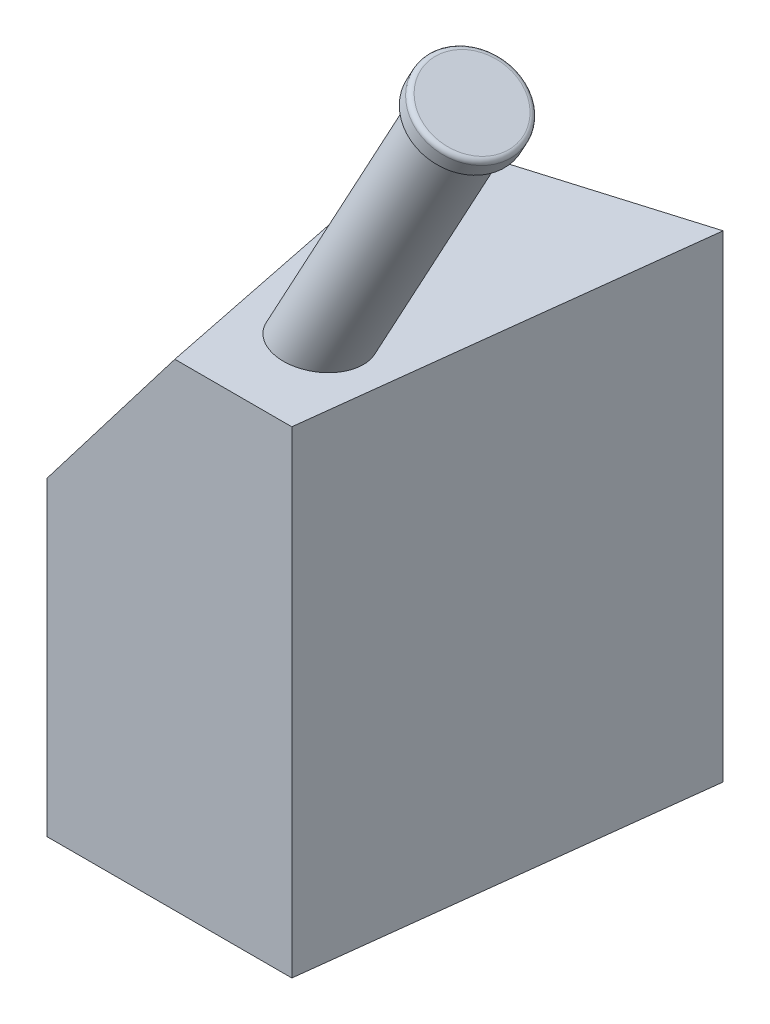
from build123d import *

# Parameters (mm, degrees)
BOSS_EXTRUDE1_DEPTH      = 254
BOSS_EXTRUDE2_DEPTH      = 165.1
BOSS_EXTRUDE2_DEPTH_BACK = 50.8
SKETCH16_R               = 20.3962
SKETCH17_R               = 25.4762
BOSS_EXTRUDE3_DEPTH      = 10.16
FILLET1_R                = 2.54
CUT_EXTRUDE5_DEPTH       = 518.859576539
CUT_EXTRUDE14_DEPTH      = 516.224718566
CUT_EXTRUDE16_DEPTH      = 488.341428756


with BuildPart() as part:
    # Sketch2 → Boss-Extrude1 (new body)
    with BuildSketch(Plane(origin=(0, 0, 0), x_dir=(1, 0, 0), z_dir=(0, 1, 0))):
        Polygon((0, 0), (130.302, 0), (154.729351402, 205.052140948), (-52.123869843, 143.209155408), align=None)
    extrude(amount=BOSS_EXTRUDE1_DEPTH)

    # Sketch16 → Boss-Extrude2 (add, two sides: drawn at the far end of the back side and taken through both)
    with BuildSketch(Plane(origin=(141.332693429, 246.526276938, 16.836612147), x_dir=(0.11829111292954252, 0, -0.9929789587911166), z_dir=(0.4964894793955593, 0.8660254037844382, 0.059145556464771376)).offset(-BOSS_EXTRUDE2_DEPTH_BACK)):
        with Locations((59.539258978, 48.389402794)):
            Circle(SKETCH16_R)
    extrude(amount=BOSS_EXTRUDE2_DEPTH + BOSS_EXTRUDE2_DEPTH_BACK)

    # Sketch17 → Boss-Extrude3 (add)
    with BuildSketch(Plane(origin=(223.303106477, 389.507071103, 26.601543519), x_dir=(0.8680427390684899, -0.49533563558134813, -0.0338291482851031), z_dir=(0.49648947939555943, 0.866025403784438, 0.0591455564647714))):
        with Locations((-39.824375463, 65.578020566)):
            Circle(SKETCH17_R)
    extrude(amount=-BOSS_EXTRUDE3_DEPTH)

    # Fillet1
    fillet1_edges = [part.edges().sort_by_distance(p)[0] for p in [
        (181.27682421, 404.902954398, -17.82477014),
        (166.619416089, 426.321042219, -36.615010578),
    ]]
    fillet(fillet1_edges, radius=FILLET1_R)

    # Sketch37 → Cut-Extrude5 (cut, through all)
    with BuildSketch(Plane(origin=(-74.235573647, 46.74358774, 4.634969946), x_dir=(0.044647299319108304, -0.028112868945999136, 0.9986071726475507), z_dir=(-0.8450404746161061, 0.5320929256471292, 0.052760920546034554))):
        Polygon((-177.193506747, 239.03382897), (-117.503506747, 239.03382897), (-4.641434663, 139.710775348), (-148.050333908, 53.903642677), align=None)
    extrude(amount=CUT_EXTRUDE5_DEPTH, mode=Mode.SUBTRACT)

    # Sketch44 → Cut-Extrude14 (cut, through all)
    with BuildSketch(Plane(origin=(-77.674407605, 59.476403537, 15.773333495), x_dir=(-0.1263811849383747, 0.0967718787528128, -0.9872502213604327), z_dir=(0.7838483769002791, -0.6002039000265006, -0.1591760045477231))):
        Polygon((129.968891102, 229.15973728), (15.977037182, 243.05344524), (15.977037182, 131.08466752), align=None)
    extrude(amount=-CUT_EXTRUDE14_DEPTH, mode=Mode.SUBTRACT)


with BuildPart() as cut_extrude14_piece_1:
    # of the separate pieces the step leaves, piece 1, a body of its own (cut_extrude14_pieces)
    add(part.part.solids().sort_by_distance((184.841119327, 402.703249872, -58.480994732))[0])


with BuildPart() as cut_extrude14_piece_2:
    # of the separate pieces the step leaves, piece 2, a body of its own (cut_extrude14_pieces)
    add(part.part.solids().sort_by_distance((-24.451989708, 254, -67.181289582))[0])

    # Sketch54 → Cut-Extrude16 (cut, through all)
    with BuildSketch(Plane(origin=(48.324107263, 47.921039084, 57.272316376), x_dir=(0.8395487608428681, -0.34863488518909047, -0.4166672473286021), z_dir=(0.5432843437530708, 0.5387528450113599, 0.6438846898513436))):
        Polygon((-57.559619545, 126.622022749), (-3.698754498, 267.020987435), (-89.385563224, 299.892779983), (-143.246428271, 159.493815297), align=None)
    extrude(amount=-CUT_EXTRUDE16_DEPTH, mode=Mode.SUBTRACT)


solid = cut_extrude14_piece_1.part
